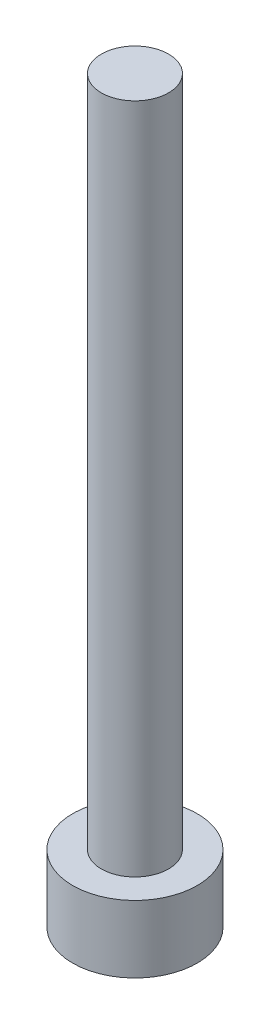
from build123d import *

# Parameters (mm, degrees)
SKETCH1_R           = 2.78
BOSS_EXTRUDE1_DEPTH = 3
SKETCH2_R           = 1.5
BOSS_EXTRUDE2_DEPTH = 30


with BuildPart() as part:
    # Sketch1 → Boss-Extrude1 (new body)
    with BuildSketch(Plane(origin=(0, 0, 0), x_dir=(1, 0, 0), z_dir=(0, 1, 0))):
        Circle(SKETCH1_R)
    extrude(amount=BOSS_EXTRUDE1_DEPTH)

    # Sketch2 → Boss-Extrude2 (add)
    with BuildSketch(Plane(origin=(0, 3, 0), x_dir=(1, 0, 0), z_dir=(0, 1, 0))):
        Circle(SKETCH2_R)
    extrude(amount=BOSS_EXTRUDE2_DEPTH)


solid = part.part
